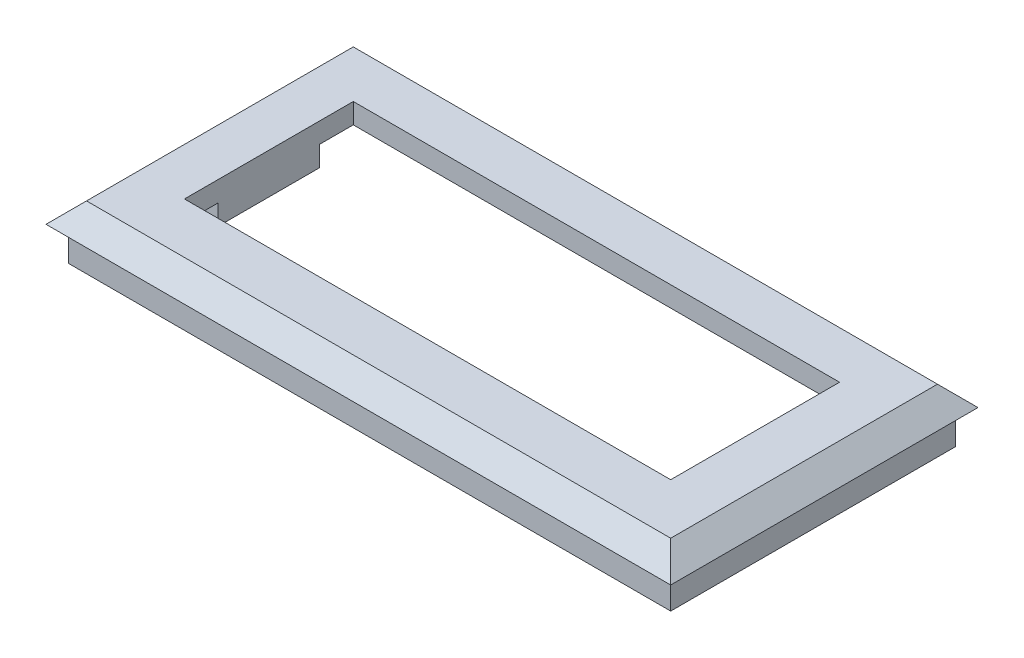
from build123d import *

# Parameters (mm, degrees)
TOP_EDGE_OUTLINE_W   = 86.5
TOP_EDGE_OUTLINE_H   = 39.5
TOP_EDGE_DEPTH       = 3
TOP_EDGE_DRAFT       = 45
SKETCH13_W           = 72
SKETCH13_H           = 25
DISPLAY_HOLE_DEPTH   = 6
SKETCH14_W           = 92.5
SKETCH14_H           = 45.5
SKETCH14_W_2         = 89.5
SKETCH14_H_2         = 42.5
BOSS_EXTRUDE5_DEPTH  = 5
SKETCH15_W           = 128.5
SKETCH15_H           = 45.5
SKETCH15_W_2         = 89.5
SKETCH15_H_2         = 42.5
BOSS_EXTRUDE6_DEPTH  = 2
SKETCH16_W           = 128.5
SKETCH16_H           = 45.5
SKETCH16_W_2         = 125.5
SKETCH16_H_2         = 42.5
BOSS_EXTRUDE7_DEPTH  = 37
LOFT2_OUTLINE_W      = 33
LOFT2_OUTLINE_H      = 42.5
LOFT2_DEPTH          = 1.5
LOFT2_DRAFT          = 45
SKETCH19_R           = 2.75
SKETCH19_R_2         = 2
BOSS_EXTRUDE8_DEPTH  = 1
CUT_EXTRUDE3_START   = -11
SKETCH20_R           = 2
CUT_EXTRUDE3_DEPTH   = 11
SKETCH21_W           = 12
SKETCH21_H           = 8
CUT_EXTRUDE4_DEPTH   = 11
SKETCH22_W           = 4
SKETCH22_H           = 15
BOSS_EXTRUDE9_DEPTH  = 3
SKETCH24_W           = 42.5
SKETCH24_H           = 37
CUT_EXTRUDE5_DEPTH   = 17
SKETCH26_W           = 65.330388672
SKETCH26_H           = 66.528532866
CUT_EXTRUDE6_DEPTH   = 47
SKETCH27_W           = 135.174847233
SKETCH27_H           = 89.815373094
CUT_EXTRUDE7_DEPTH   = 47
SKETCH28_W           = 107.897480511
SKETCH28_H           = 56.576939502
SKETCH28_W_2         = 83.398406197
SKETCH28_H_2         = 34.654132256
CUT_EXTRUDE9_DEPTH   = 20.5
SKETCH29_W           = 89.2
SKETCH29_H           = 42.2
SKETCH29_W_2         = 86.2
SKETCH29_H_2         = 39.2
BOSS_EXTRUDE11_DEPTH = 5


# Read off the part's stored shape, not the designer's step: Top Edge, Loft2
with BuildPart() as part:
    # Top Edge outline → Top Edge (with draft: the straight prism first)
    with BuildSketch(Plane(origin=(0, 0, 0), x_dir=(1, 0, 0), z_dir=(0, 1, 0))):
        with Locations((0.25, -0.25)):
            Rectangle(TOP_EDGE_OUTLINE_W, TOP_EDGE_OUTLINE_H)
    extrude(amount=-TOP_EDGE_DEPTH)
    # Top Edge: the draft: its side faces are tilted about the plane it starts from
    top_edge_sides = [part.faces().sort_by_distance(p)[0] for p in [
        (-43, -1.5, 0.25),
        (0.25, -1.5, 20),
        (43.5, -1.5, 0.25),
        (0.25, -1.5, -19.5),
    ]]
    draft(top_edge_sides, Plane(origin=(0, 0, 0), x_dir=(1, 0, 0), z_dir=(0, 1, 0)), TOP_EDGE_DRAFT)

    # Sketch13 → Display Hole (cut)
    with BuildSketch(Plane(origin=(0, 0, 0), x_dir=(1, 0, 0), z_dir=(0, 1, 0))):
        Rectangle(SKETCH13_W, SKETCH13_H)
    extrude(amount=-DISPLAY_HOLE_DEPTH, mode=Mode.SUBTRACT)

    # Sketch14 → Boss-Extrude5 (add)
    with BuildSketch(Plane.XZ.offset(3)):
        with Locations((0.25, 0.25)):
            Rectangle(SKETCH14_W, SKETCH14_H)
        with Locations((0.25, 0.25)):
            Rectangle(SKETCH14_W_2, SKETCH14_H_2, mode=Mode.SUBTRACT)
    extrude(amount=BOSS_EXTRUDE5_DEPTH)

    # Sketch15 → Boss-Extrude6 (add)
    with BuildSketch(Plane.XZ.offset(8)):
        with Locations((18.25, 0.25)):
            Rectangle(SKETCH15_W, SKETCH15_H)
        with Locations((0.25, 0.25)):
            Rectangle(SKETCH15_W_2, SKETCH15_H_2, mode=Mode.SUBTRACT)
    extrude(amount=BOSS_EXTRUDE6_DEPTH)

    # Sketch16 → Boss-Extrude7 (add)
    with BuildSketch(Plane.XZ.offset(10)):
        with Locations((18.25, 0.25)):
            Rectangle(SKETCH16_W, SKETCH16_H)
        with Locations((18.25, 0.25)):
            Rectangle(SKETCH16_W_2, SKETCH16_H_2, mode=Mode.SUBTRACT)
    extrude(amount=BOSS_EXTRUDE7_DEPTH)


with BuildPart() as loft2_tool:
    # Loft2 outline → Loft2 (with draft: the straight prism first)
    with BuildSketch(Plane(origin=(0, -6.5, 0), x_dir=(1, 0, 0), z_dir=(0, 1, 0))):
        with Locations((64.5, -0.25)):
            Rectangle(LOFT2_OUTLINE_W, LOFT2_OUTLINE_H)
    extrude(amount=-LOFT2_DEPTH)
    # Loft2: the draft: its side faces are tilted about the plane it starts from
    loft2_sides = [loft2_tool.faces().sort_by_distance(p)[0] for p in [
        (81, -7.25, 0.25),
        (64.5, -7.25, -21),
        (48, -7.25, 0.25),
        (64.5, -7.25, 21.5),
    ]]
    draft(loft2_sides, Plane(origin=(0, -6.5, 0), x_dir=(1, 0, 0), z_dir=(0, 1, 0)), LOFT2_DRAFT)


with BuildPart() as part_1:
    add(part.part)

    # Loft2: add loft2_tool
    add(loft2_tool.part)

    # Sketch19 → Boss-Extrude8 (add)
    with BuildSketch(Plane(origin=(0, -6.5, 0), x_dir=(1, 0, 0), z_dir=(0, 1, 0))):
        with Locations(Location((64.5, 3, 0), (0, 0, 270))):
            Circle(SKETCH19_R)
        with Locations(Location((64.5, 3, 0), (0, 0, 270))):
            Circle(SKETCH19_R_2, mode=Mode.SUBTRACT)
    extrude(amount=BOSS_EXTRUDE8_DEPTH)

    # Sketch20 → Cut-Extrude3 (cut)
    with BuildSketch(Plane(origin=(0, -6.5, 0), x_dir=(1, 0, 0), z_dir=(0, 1, 0)).offset(CUT_EXTRUDE3_START)):
        with Locations(Location((64.5, 3, 0), (0, 0, 90))):
            Circle(SKETCH20_R)
    extrude(amount=CUT_EXTRUDE3_DEPTH, mode=Mode.SUBTRACT)

    # Sketch21 → Cut-Extrude4 (cut)
    with BuildSketch(Plane(origin=(82.5, 0, 0), x_dir=(0, 0, -1), z_dir=(1, 0, 0))):
        with Locations((0, -43)):
            Rectangle(SKETCH21_W, SKETCH21_H)
    extrude(amount=-CUT_EXTRUDE4_DEPTH, mode=Mode.SUBTRACT)

    # Sketch22 → Boss-Extrude9 (add)
    with BuildSketch(Plane.XZ.offset(3)):
        with Locations((-38, 0)):
            Rectangle(SKETCH22_W, SKETCH22_H)
    extrude(amount=BOSS_EXTRUDE9_DEPTH)

    # Sketch24 → Cut-Extrude5 (cut)
    with BuildSketch(Plane.ZY.offset(-81)):
        with Locations((0.25, -28.5)):
            Rectangle(SKETCH24_W, SKETCH24_H)
    extrude(amount=-CUT_EXTRUDE5_DEPTH, mode=Mode.SUBTRACT)

    # Sketch26 → Cut-Extrude6 (cut)
    with BuildSketch(Plane(origin=(46.5, 0, 0), x_dir=(0, 0, -1), z_dir=(1, 0, 0))):
        with Locations((4.479516554, -23.405372169)):
            Rectangle(SKETCH26_W, SKETCH26_H)
    extrude(amount=CUT_EXTRUDE6_DEPTH, mode=Mode.SUBTRACT)

    # Sketch27 → Cut-Extrude7 (cut)
    with BuildSketch(Plane.XZ.offset(10)):
        with Locations((-2.496201378, -4.177518392)):
            Rectangle(SKETCH27_W, SKETCH27_H)
    extrude(amount=CUT_EXTRUDE7_DEPTH, mode=Mode.SUBTRACT)

    # Sketch28 → Cut-Extrude9 (cut)
    with BuildSketch(Plane.XZ.offset(3)):
        with Locations((0.925246346, -0.196985684)):
            Rectangle(SKETCH28_W, SKETCH28_H)
        with Locations((-0.40760533, 0.012173471)):
            Rectangle(SKETCH28_W_2, SKETCH28_H_2, mode=Mode.SUBTRACT)
    extrude(amount=CUT_EXTRUDE9_DEPTH, mode=Mode.SUBTRACT)

    # Sketch29 → Boss-Extrude11 (add)
    with BuildSketch(Plane.XZ.offset(3)):
        with Locations((0.25, 0.25)):
            Rectangle(SKETCH29_W, SKETCH29_H)
        with Locations((0.25, 0.25)):
            Rectangle(SKETCH29_W_2, SKETCH29_H_2, mode=Mode.SUBTRACT)
    extrude(amount=BOSS_EXTRUDE11_DEPTH)


solid = part_1.part
